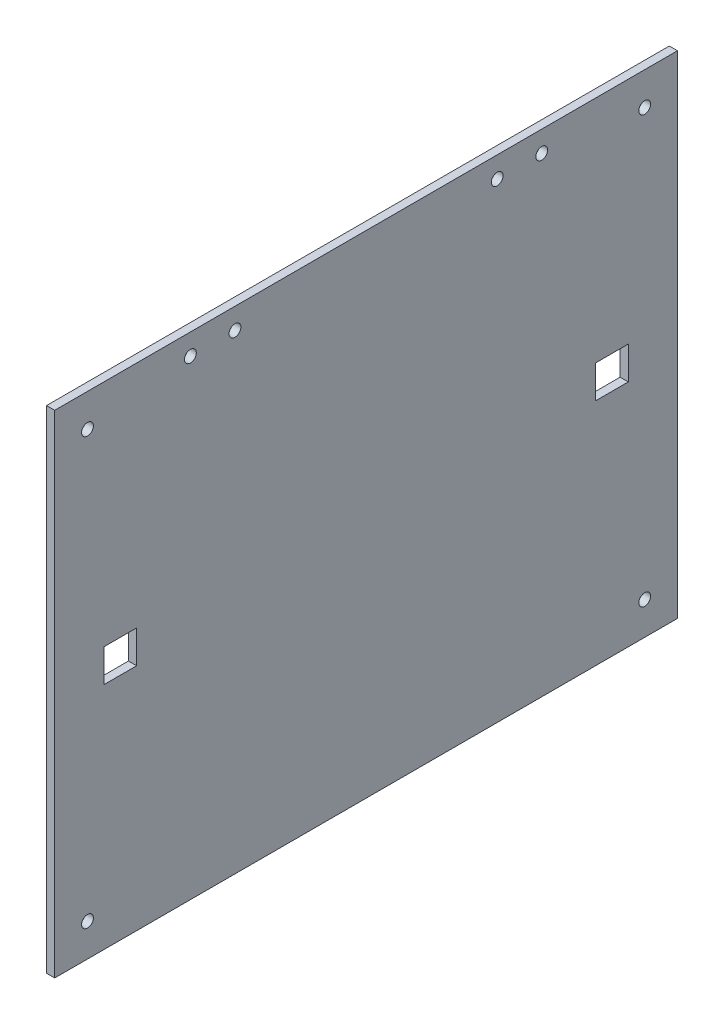
from build123d import *

# Parameters (mm, degrees)
SKETCH1_W           = 241.3
SKETCH1_H           = 190.5
BOSS_EXTRUDE1_DEPTH = 3.175
SKETCH2_R           = 2.286
CUT_EXTRUDE1_DEPTH  = 308.450842616
SKETCH3_R           = 2.286
CUT_EXTRUDE2_DEPTH  = 308.450842616
SKETCH4_W           = 12.7
SKETCH4_H           = 12.7
CUT_EXTRUDE3_DEPTH  = 308.450842616


with BuildPart() as part:
    # Sketch1 → Boss-Extrude1 (new body)
    with BuildSketch(Plane(origin=(0, 0, 0), x_dir=(0, 0, -1), z_dir=(1, 0, 0))):
        with Locations((120.65, 95.25)):
            Rectangle(SKETCH1_W, SKETCH1_H)
    extrude(amount=BOSS_EXTRUDE1_DEPTH)

    # Sketch2 → Cut-Extrude1 (cut, through all)
    with BuildSketch(Plane(origin=(3.175, 0, 0), x_dir=(0, 0, -1), z_dir=(1, 0, 0))):
        with Locations((228.6, 12.7)):
            Circle(SKETCH2_R)
        with Locations((228.6, 177.8)):
            Circle(SKETCH2_R)
        with Locations((12.7, 12.7)):
            Circle(SKETCH2_R)
        with Locations((12.7, 177.8)):
            Circle(SKETCH2_R)
    extrude(amount=-CUT_EXTRUDE1_DEPTH, mode=Mode.SUBTRACT)

    # Sketch3 → Cut-Extrude2 (cut, through all)
    with BuildSketch(Plane(origin=(3.175, 0, 0), x_dir=(0, 0, -1), z_dir=(1, 0, 0))):
        with Locations((52.578, 182.372)):
            Circle(SKETCH3_R)
        with Locations((69.85, 182.372)):
            Circle(SKETCH3_R)
        with Locations((171.45, 182.372)):
            Circle(SKETCH3_R)
        with Locations((188.722, 182.372)):
            Circle(SKETCH3_R)
    extrude(amount=-CUT_EXTRUDE2_DEPTH, mode=Mode.SUBTRACT)

    # Sketch4 → Cut-Extrude3 (cut, through all)
    with BuildSketch(Plane(origin=(3.175, 0, 0), x_dir=(0, 0, -1), z_dir=(1, 0, 0))):
        with Locations((25.4, 95.25)):
            Rectangle(SKETCH4_W, SKETCH4_H)
        with Locations((215.9, 95.25)):
            Rectangle(SKETCH4_W, SKETCH4_H)
    extrude(amount=-CUT_EXTRUDE3_DEPTH, mode=Mode.SUBTRACT)


solid = part.part
